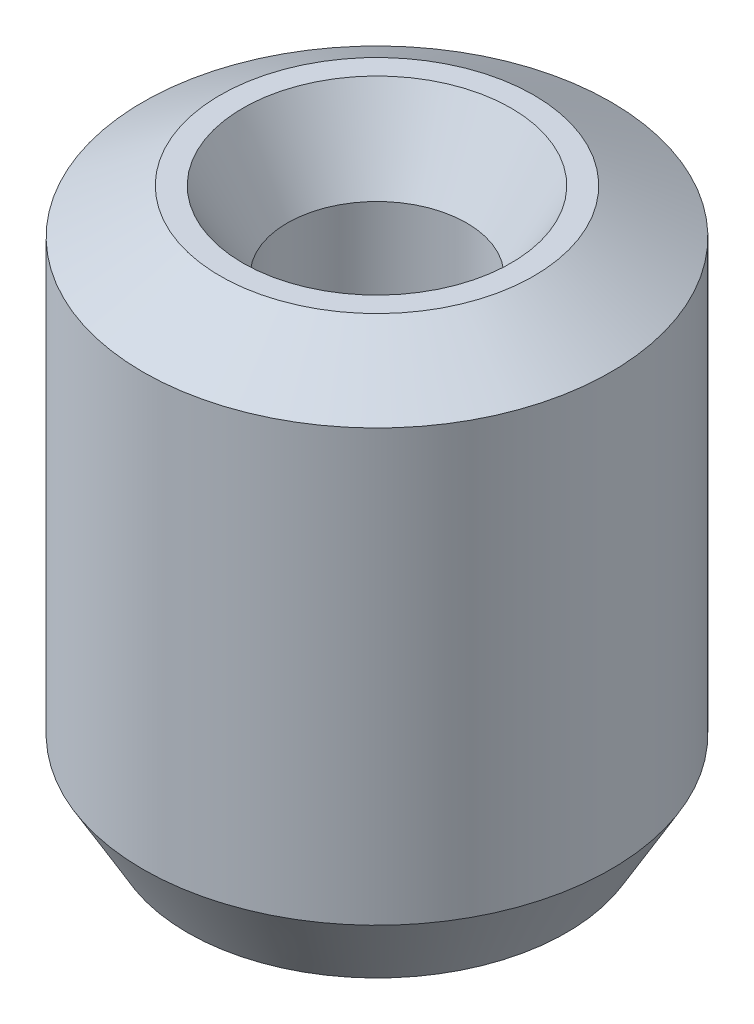
from build123d import *
from OCP.BRepFilletAPI import BRepFilletAPI_MakeChamfer

# Parameters (mm, degrees)
SKETCH1_R           = 5
BOSS_EXTRUDE1_DEPTH = 11.804713295
SKETCH2_R           = 1.915891055
CUT_EXTRUDE1_DEPTH  = 14.760496212
CHAMFER1_SIZE       = 0.951952037
CHAMFER1_SIZE2      = 1.648829295


with BuildPart() as part:
    # Sketch1 → Boss-Extrude1 (new body)
    with BuildSketch(Plane(origin=(0, 0, 0), x_dir=(1, 0, 0), z_dir=(0, 1, 0))):
        Circle(SKETCH1_R)
    extrude(amount=BOSS_EXTRUDE1_DEPTH)

    # Sketch2 → Cut-Extrude1 (cut, through all)
    with BuildSketch(Plane(origin=(0, 0, 0), x_dir=(1, 0, 0), z_dir=(0, 1, 0))):
        Circle(SKETCH2_R)
    extrude(amount=CUT_EXTRUDE1_DEPTH, mode=Mode.SUBTRACT)

    # Chamfer1: one chamfer whose edges measure the first distance from different faces: ONE call of the kernel's chamfer builder (chamfer() names one face for all edges)
    chamfer1_edges_1 = [part.edges().sort_by_distance(p)[0] for p in [
        (-1.915891055, 11.804713295, 0),
    ]]
    chamfer1_side_1 = [part.faces().sort_by_distance(p)[0] for p in [
        (-4.858578644, 11.804713295, 0),
    ]]
    chamfer1_edges_2 = [part.edges().sort_by_distance(p)[0] for p in [
        (-1.915891055, 0, 0),
    ]]
    chamfer1_side_2 = [part.faces().sort_by_distance(p)[0] for p in [
        (-1.915891055, 5.902356648, 0),
    ]]
    chamfer1_edges_3 = [part.edges().sort_by_distance(p)[0] for p in [
        (-5, 0, 0),
    ]]
    chamfer1_side_3 = [part.faces().sort_by_distance(p)[0] for p in [
        (-4.858578644, 0, 0),
    ]]
    chamfer1_edges_4 = [part.edges().sort_by_distance(p)[0] for p in [
        (-5, 11.804713295, 0),
    ]]
    chamfer1_side_4 = [part.faces().sort_by_distance(p)[0] for p in [
        (-5, 5.902356648, 0),
    ]]
    chamfer1 = BRepFilletAPI_MakeChamfer(part.part.solid().wrapped)
    for e in chamfer1_edges_1:
        chamfer1.Add(CHAMFER1_SIZE, CHAMFER1_SIZE2, e.wrapped, chamfer1_side_1[0].wrapped)  # the first distance lies on this face
    for e in chamfer1_edges_2:
        chamfer1.Add(CHAMFER1_SIZE, CHAMFER1_SIZE2, e.wrapped, chamfer1_side_2[0].wrapped)  # the first distance lies on this face
    for e in chamfer1_edges_3:
        chamfer1.Add(CHAMFER1_SIZE, CHAMFER1_SIZE2, e.wrapped, chamfer1_side_3[0].wrapped)  # the first distance lies on this face
    for e in chamfer1_edges_4:
        chamfer1.Add(CHAMFER1_SIZE, CHAMFER1_SIZE2, e.wrapped, chamfer1_side_4[0].wrapped)  # the first distance lies on this face
    add(Compound.cast(chamfer1.Shape()), mode=Mode.REPLACE)


solid = part.part
